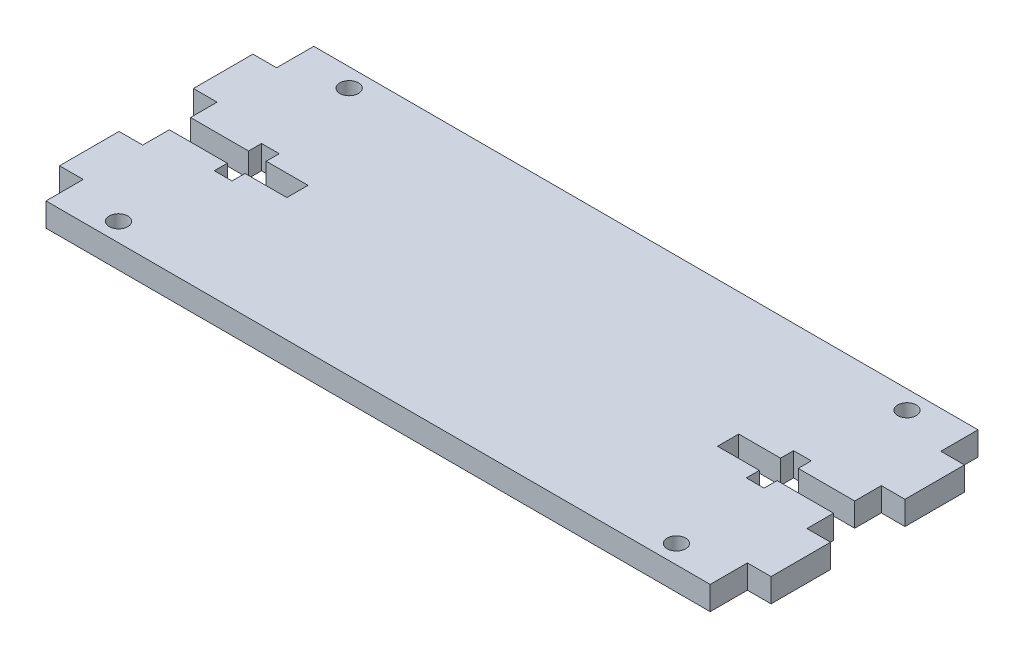
from build123d import *

# Parameters (mm, degrees)
SKETCH1_R           = 1.25
BOSS_EXTRUDE1_DEPTH = 3.18
CUT_EXTRUDE1_DEPTH  = 52.297940265


with BuildPart() as part:
    # Sketch1 → Boss-Extrude1 (new body)
    with BuildSketch(Plane(origin=(0, 0, 0), x_dir=(1, 0, 0), z_dir=(0, 1, 0))):
        Polygon((40, 18), (37.5, 18), (-37.5, 18), (-40, 18), (-44.750848892, 18), (-44.750848892, 13), (-47.930848892, 13), (-47.930848892, 5), (-44.750848892, 5), (-44.750848892, -5), (-47.930848892, -5), (-47.930848892, -13), (-44.750848892, -13), (-44.750848892, -18), (-40, -18), (-37.5, -18), (37.5, -18), (40, -18), (44.539151108, -18), (44.539151108, -13), (47.719151108, -13), (47.719151108, -5), (44.539151108, -5), (44.539151108, 5), (47.719151108, 5), (47.719151108, 13), (44.539151108, 13), (44.539151108, 18), align=None)
        with Locations((-37.5, -15.5)):
            Circle(SKETCH1_R, mode=Mode.SUBTRACT)
        with Locations((37.5, -15.5)):
            Circle(SKETCH1_R, mode=Mode.SUBTRACT)
        with Locations((-37.5, 15.5)):
            Circle(SKETCH1_R, mode=Mode.SUBTRACT)
        with Locations((37.5, 15.5)):
            Circle(SKETCH1_R, mode=Mode.SUBTRACT)
    extrude(amount=BOSS_EXTRUDE1_DEPTH)

    # Sketch2 → Cut-Extrude1 (cut, through all)
    with BuildSketch(Plane(origin=(0, 3.18, 0), x_dir=(1, 0, 0), z_dir=(0, 1, 0))):
        Polygon((-44.750848892, 1.425), (-36.950848892, 1.425), (-36.950848892, 3.175), (-34.570848892, 3.175), (-34.570848892, 1.425), (-28.950848892, 1.425), (-28.950848892, -1.425), (-34.570848892, -1.425), (-34.570848892, -3.175), (-36.950848892, -3.175), (-36.950848892, -1.425), (-44.750848892, -1.425), align=None)
    cut_extrude1 = extrude(amount=-CUT_EXTRUDE1_DEPTH, mode=Mode.SUBTRACT)

    # Mirror1: Cut-Extrude1 across plane
    add(cut_extrude1.mirror(Plane(origin=(0, 0, 0), x_dir=(0, 0, 1), z_dir=(1, 0, 0))), mode=Mode.SUBTRACT)


solid = part.part
